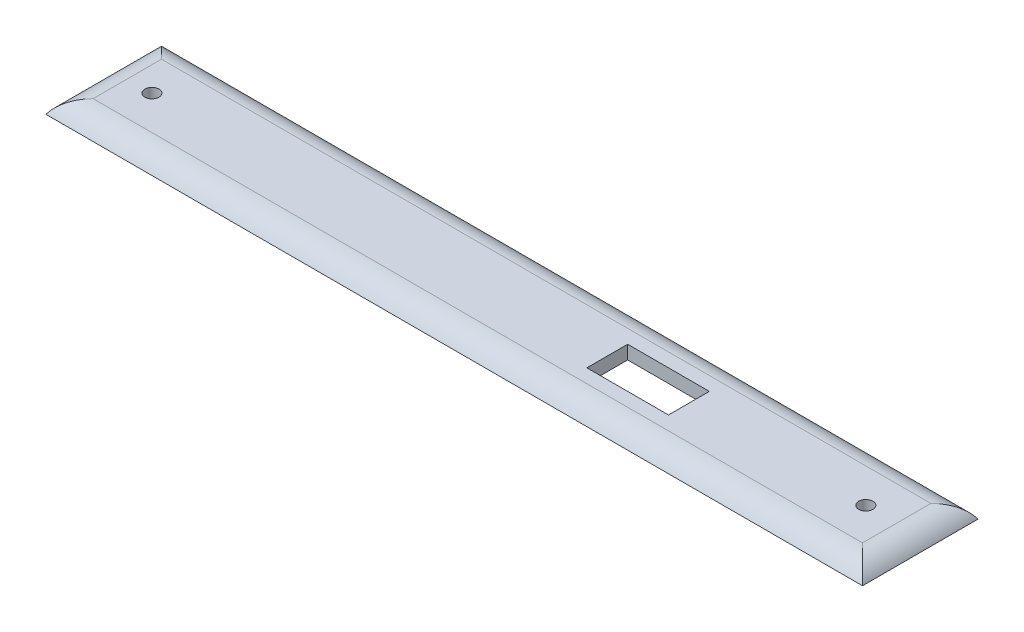
from build123d import *

# Parameters (mm, degrees)
SKETCH_1_W          = 21
SKETCH_1_H          = 42.43
SKETCH_1_R          = 2.6
EXTRUDE_1_DEPTH     = 5
FILLET_1_R          = 10
SKETCH_3_W          = 30
SKETCH_3_H          = 7.5
CUT_EXTRUDE_2_DEPTH = 5


with BuildPart() as part:
    # 草图1 → 凸台-拉伸1 (new body)
    # profile 1 of 3: a face of its own
    with BuildSketch(Plane(origin=(0, 0, 0), x_dir=(1, 0, 0), z_dir=(0, 1, 0))):
        with Locations((-139.5, 0)):
            Rectangle(SKETCH_1_W, SKETCH_1_H)
        with Locations(Location((-132.3, 0, 0), (0, 0, 270))):
            Circle(SKETCH_1_R, mode=Mode.SUBTRACT)
    # profile 2 of 3: a face of its own
    with BuildSketch(Plane(origin=(0, 0, 0), x_dir=(1, 0, 0), z_dir=(0, 1, 0))):
        with BuildLine():
            Line((129, 21.215), (-129, 21.215))
            Line((-129, 21.215), (-129, -21.215))
            Line((-129, -21.215), (129, -21.215))
            Line((129, -21.215), (129, -2.4))
            ThreePointArc((129, -2.4), (127.4, 0), (129, 2.4))
            Line((129, 2.4), (129, 21.215))
        make_face()
    # profile 3 of 3: a face of its own
    with BuildSketch(Plane(origin=(0, 0, 0), x_dir=(1, 0, 0), z_dir=(0, 1, 0))):
        with BuildLine():
            Line((150, 21.215), (129, 21.215))
            Line((129, 21.215), (129, 2.4))
            ThreePointArc((129, 2.4), (131.44222051, 2.163330765), (132.6, 0))
            ThreePointArc((132.6, 0), (131.44222051, -2.163330765), (129, -2.4))
            Line((129, -2.4), (129, -21.215))
            Line((129, -21.215), (150, -21.215))
            Line((150, -21.215), (150, 21.215))
        make_face()
    extrude(amount=EXTRUDE_1_DEPTH)

    # 圆角1
    # the kernel refuses this fillet: 10 mm, written as the material it takes off along each edge
    with BuildSketch(Plane(origin=(150, 5, 42.865635095), x_dir=(-1, 0, 0), z_dir=(0, 0, -1)), Plane(origin=(-150, 5, -42.865635095), x_dir=(1, 0, 0), z_dir=(0, 0, 1))) as fillet_1_piece_1:
        with BuildLine():
            CenterArc((8.660254038, -10), FILLET_1_R, 90, 60)
            Line((0, -5), (-0.173205081, -4.9))
            ThreePointArc((-0.173205081, -4.9), (-0.2, -2.5), (-0.2, 0))
            Line((-0.2, 0), (0, 0.2))
            Line((0, 0.2), (8.660254038, 0.2))
            Line((8.660254038, 0.2), (8.660254038, 0))
        make_face()
    extrude(amount=85.731270189, mode=Mode.SUBTRACT)
    with BuildSketch(Plane(origin=(-171.650635095, 5, 21.215), x_dir=(0, 0, -1), z_dir=(1, 0, 0))) as fillet_1_piece_2:
        with BuildLine():
            CenterArc((8.660254038, -10), FILLET_1_R, 90, 60)
            Line((0, -5), (-0.173205081, -4.9))
            ThreePointArc((-0.173205081, -4.9), (-0.2, -2.5), (-0.2, 0))
            Line((-0.2, 0), (0, 0.2))
            Line((0, 0.2), (8.660254038, 0.2))
            Line((8.660254038, 0.2), (8.660254038, 0))
        make_face()
    extrude(amount=343.301270189, mode=Mode.SUBTRACT)
    with BuildSketch(Plane(origin=(-171.650635095, 5, -21.215), x_dir=(0, -1, 0), z_dir=(1, 0, 0))) as fillet_1_piece_3:
        with BuildLine():
            CenterArc((10, -8.660254038), FILLET_1_R, 120, 60)
            Line((0, -8.660254038), (-0.2, -8.660254038))
            Line((-0.2, -8.660254038), (-0.2, 0))
            Line((-0.2, 0), (0, 0.2))
            ThreePointArc((0, 0.2), (2.5, 0.2), (4.9, 0.173205081))
            Line((4.9, 0.173205081), (5, 0))
        make_face()
    extrude(amount=343.301270189, mode=Mode.SUBTRACT)

    # 草图3 → 切除-拉伸2 (cut)
    with BuildSketch(Plane(origin=(0, 5, 0), x_dir=(1, 0, 0), z_dir=(0, 1, 0))):
        with Locations((50, 3.75)):
            Rectangle(SKETCH_3_W, SKETCH_3_H)
        with Locations((50, -3.75)):
            Rectangle(SKETCH_3_W, SKETCH_3_H)
    extrude(amount=-CUT_EXTRUDE_2_DEPTH, mode=Mode.SUBTRACT)


solid = part.part
